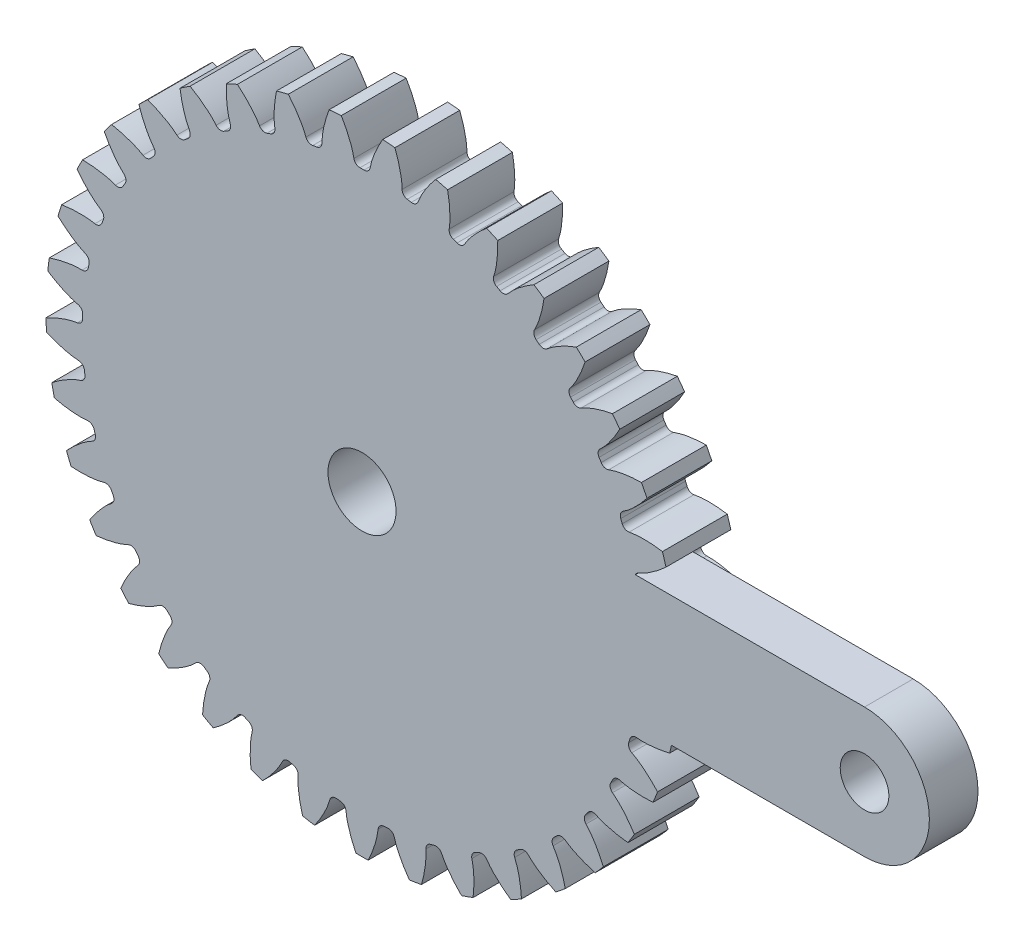
from build123d import *

# Parameters (mm, degrees)
SKETCH_1_R          = 19.5
LASHENA_DEPTH       = 4
CUT_EXTRUDEA_DEPTH  = 10
WWW_KYTOOL_CN_COUNT = 37
EXTRUDE_1_DEPTH     = 3
SKETCH_3_R          = 1.5
CUT_EXTRUDE_1_DEPTH = 41.177730293
SKETCH_4_R          = 2.1
CUT_EXTRUDE_2_DEPTH = 41.264748996


with BuildPart() as part:
    # 草图1 → LaShenA (new body)
    with BuildSketch(Plane.XY):
        Circle(SKETCH_1_R)
    extrude(amount=LASHENA_DEPTH)

    # SketchA → Cut-ExtrudeA (cut)
    with BuildSketch(Plane.XY.offset(4)):
        with BuildLine():
            ThreePointArc((0.1249143, 17.249547716), (0, 17.25), (-0.1249143, 17.249547716))
            ThreePointArc((-0.1249143, 17.249547716), (-0.368395248, 17.335514887), (-0.500725106, 17.557240247))
            add(Edge.make_bspline(
                [(-0.500725106, 17.557240247), (-0.504654552, 17.577516403), (-0.514803667, 17.62928538), (-0.529409589, 17.69861485), (-0.545520522, 17.766323591), (-0.559812494, 17.822767359), (-0.576017849, 17.88286252), (-0.594234511, 17.94656742), (-0.614580466, 18.01383262), (-0.637166484, 18.084607601), (-0.662104085, 18.158838813), (-0.689503138, 18.236470276), (-0.719472493, 18.317443428), (-0.752119733, 18.401697205), (-0.787551176, 18.489168044), (-0.82587181, 18.579789912), (-0.867185249, 18.673494338), (-0.911593676, 18.770210429), (-0.959197802, 18.86986491), (-1.010096808, 18.97238214), (-1.064388307, 19.077684152), (-1.122168285, 19.185690679), (-1.183531062, 19.296319186), (-1.248569243, 19.4094849), (-1.317373674, 19.525100849), (-1.390033372, 19.643077891), (-1.493608365, 19.805665437), (-1.575211808, 19.927457939), (-1.631562781, 20.008931386)],
                knots=[0.105238042, 0.105238042, 0.105238042, 0.105238042, 0.125625563, 0.157342855, 0.175184979, 0.194349116, 0.214835266, 0.23664343, 0.259773607, 0.284225798, 0.310000003, 0.337096221, 0.365514453, 0.395254698, 0.426316957, 0.458701229, 0.492407515, 0.527435814, 0.563786127, 0.601458453, 0.640452793, 0.680769147, 0.722407514, 0.765367894, 0.809650288, 0.855254696, 0.902181117, 1, 1, 1, 1], degree=3))
            ThreePointArc((-1.631562781, 20.008931386), (0, 20.0753414), (1.631562781, 20.008931386))
            add(Edge.make_bspline(
                [(0.500725106, 17.557240247), (0.504654552, 17.577516403), (0.514803667, 17.62928538), (0.529409589, 17.69861485), (0.545520522, 17.766323591), (0.559812494, 17.822767359), (0.576017849, 17.88286252), (0.594234511, 17.94656742), (0.614580466, 18.01383262), (0.637166484, 18.084607601), (0.662104085, 18.158838813), (0.689503138, 18.236470276), (0.719472493, 18.317443428), (0.752119733, 18.401697205), (0.787551176, 18.489168044), (0.82587181, 18.579789912), (0.867185249, 18.673494338), (0.911593676, 18.770210429), (0.959197802, 18.86986491), (1.010096808, 18.97238214), (1.064388307, 19.077684152), (1.122168285, 19.185690679), (1.183531062, 19.296319186), (1.248569243, 19.4094849), (1.317373674, 19.525100849), (1.390033372, 19.643077891), (1.493608365, 19.805665437), (1.575211808, 19.927457939), (1.631562781, 20.008931386)],
                knots=[0.105238042, 0.105238042, 0.105238042, 0.105238042, 0.125625563, 0.157342855, 0.175184979, 0.194349116, 0.214835266, 0.23664343, 0.259773607, 0.284225798, 0.310000003, 0.337096221, 0.365514453, 0.395254698, 0.426316957, 0.458701229, 0.492407515, 0.527435814, 0.563786127, 0.601458453, 0.640452793, 0.680769147, 0.722407514, 0.765367894, 0.809650288, 0.855254696, 0.902181117, 1, 1, 1, 1], degree=3))
            ThreePointArc((0.500725106, 17.557240247), (0.368395248, 17.335514887), (0.1249143, 17.249547716))
        make_face()
    cut_extrudea = extrude(amount=-CUT_EXTRUDEA_DEPTH, mode=Mode.SUBTRACT)

    # www.KYTool.cn: Cut-ExtrudeA ×37 about axis
    www_kytool_cn_axis = Axis((0, 0, -88.99), (0, 0, 1))
    for i in range(1, WWW_KYTOOL_CN_COUNT):
        add(cut_extrudea.rotate(www_kytool_cn_axis, i * 360 / WWW_KYTOOL_CN_COUNT), mode=Mode.SUBTRACT)

    # 草图2 → 凸台-拉伸1 (add)
    with BuildSketch(Plane.XY.offset(4)):
        with BuildLine():
            Line((0, 4), (31, 4))
            ThreePointArc((31, 4), (35, 0), (31, -4))
            Line((31, -4), (0, -4))
            ThreePointArc((0, -4), (-4, 0), (0, 4))
        make_face()
    extrude(amount=-EXTRUDE_1_DEPTH)

    # 草图3 → 切除-拉伸1 (cut, through all)
    with BuildSketch(Plane(origin=(0, 0, 1), x_dir=(-1, 0, 0), z_dir=(0, 0, -1))):
        with Locations((-31, 0)):
            Circle(SKETCH_3_R)
    extrude(amount=-CUT_EXTRUDE_1_DEPTH, mode=Mode.SUBTRACT)

    # 草图4 → 切除-拉伸2 (cut, through all)
    with BuildSketch(Plane(origin=(0, 0, 0), x_dir=(-1, 0, 0), z_dir=(0, 0, -1))):
        Circle(SKETCH_4_R)
    extrude(amount=-CUT_EXTRUDE_2_DEPTH, mode=Mode.SUBTRACT)


solid = part.part
